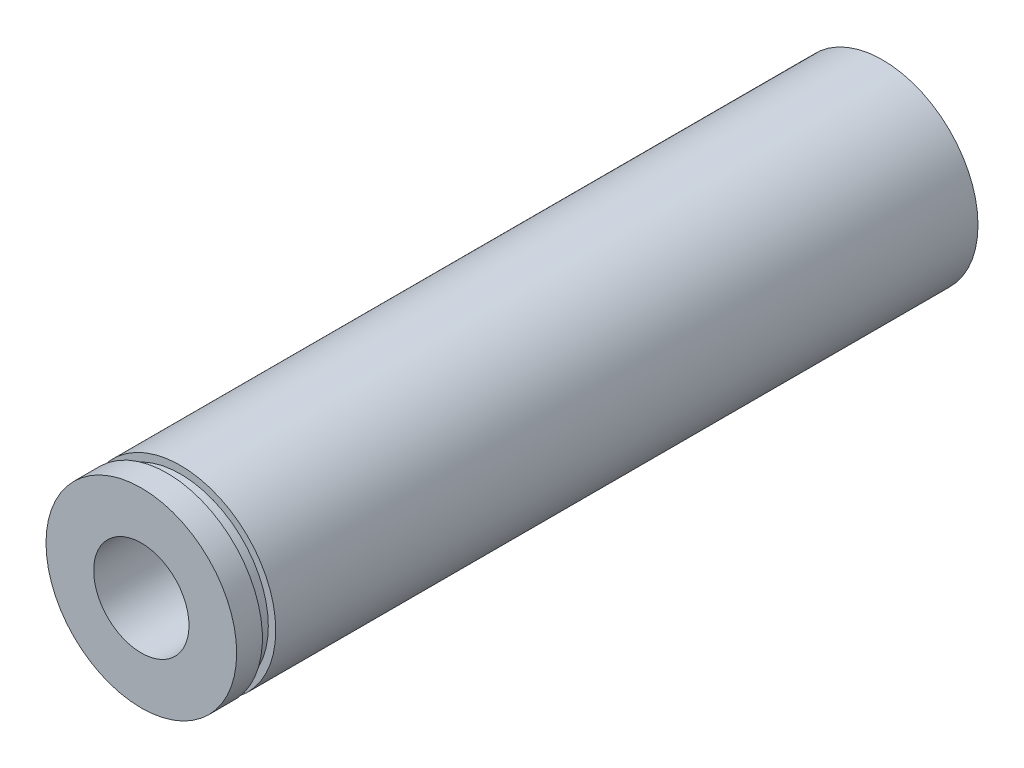
from build123d import *

# Parameters (mm, degrees)
SKETCH1_R           = 6.35
SKETCH1_R_2         = 3.175
BOSS_EXTRUDE1_DEPTH = 24.6888
SKETCH2_W           = 0.889
SKETCH2_H           = 1.0033


with BuildPart() as part:
    # Sketch1 → Boss-Extrude1 (new, symmetric)
    with BuildSketch(Plane.XY):
        Circle(SKETCH1_R)
        Circle(SKETCH1_R_2, mode=Mode.SUBTRACT)
    extrude(amount=BOSS_EXTRUDE1_DEPTH, both=True)

    # Sketch2 → Cut-Revolve1 (revolve, cut)
    with BuildSketch(Plane(origin=(0, 0, 0), x_dir=(0, 0, -1), z_dir=(1, 0, 0))):
        with Locations((-22.5298, 6.35635)):
            Rectangle(SKETCH2_W, SKETCH2_H)
    revolve(axis=Axis((0, 0, 2.405637885), (0, 0, -1)), mode=Mode.SUBTRACT)


solid = part.part
